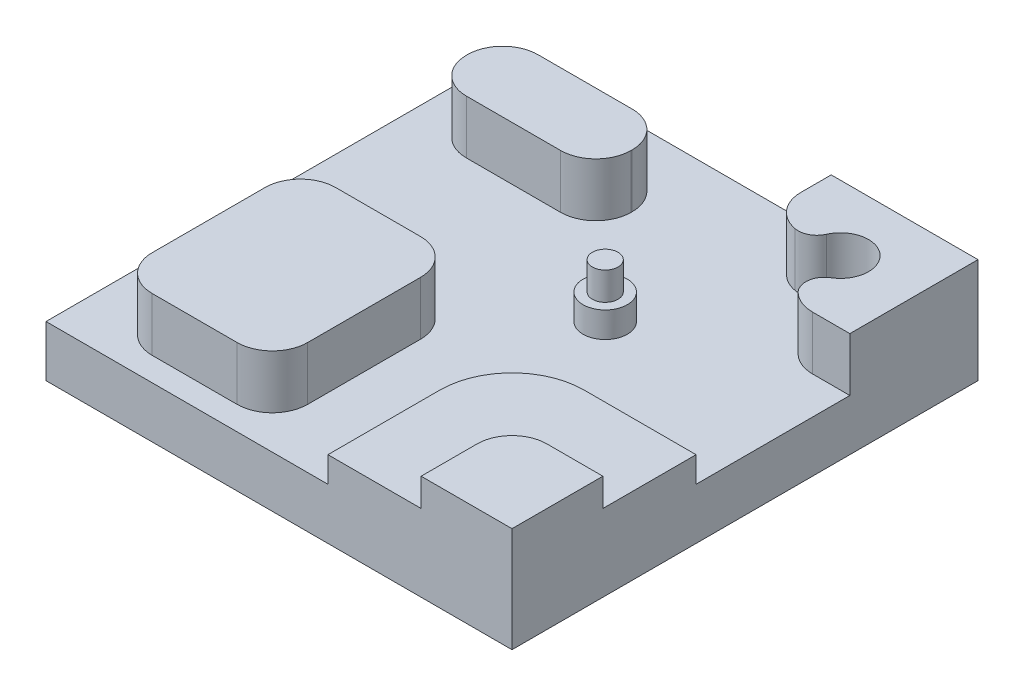
from build123d import *

# Parameters (mm, degrees)
SKETCH1_W           = 50
SKETCH1_H           = 50
BOSS_EXTRUDE1_DEPTH = 5.5
SKETCH2_W           = 9.75
SKETCH2_H           = 9.75
BOSS_EXTRUDE2_DEPTH = 5.75
SKETCH3_W           = 19.75
SKETCH3_H           = 19.75
BOSS_EXTRUDE3_DEPTH = 2.75
FILLET1_R           = 3.75
SKETCH4_W           = 15.75
SKETCH4_H           = 7
BOSS_EXTRUDE4_DEPTH = 5.75
SKETCH5_W           = 7.75
SKETCH5_H           = 6.75
BOSS_EXTRUDE5_DEPTH = 5.75
FILLET2_R           = 3.75
SKETCH6_W           = 16.69
SKETCH6_H           = 19.69
BOSS_EXTRUDE6_DEPTH = 5.75
FILLET3_R           = 3.79
SKETCH7_W           = 17.69
SKETCH7_H           = 7.69
BOSS_EXTRUDE7_DEPTH = 5.75
FILLET4_R           = 3.79
SKETCH8_R           = 2.375
BOSS_EXTRUDE8_DEPTH = 2.75
SKETCH9_R           = 1.375
BOSS_EXTRUDE9_DEPTH = 5.75
FILLET5_R           = 7.75
SKETCH10_R          = 3
CUT_EXTRUDE2_DEPTH  = 5.75
FILLET7_R           = 2


with BuildPart() as part:
    # Sketch1 → Boss-Extrude1 (new body)
    with BuildSketch(Plane(origin=(0, 0, 0), x_dir=(1, 0, 0), z_dir=(0, 1, 0))):
        Rectangle(SKETCH1_W, SKETCH1_H)
    extrude(amount=BOSS_EXTRUDE1_DEPTH)

    # Sketch2 → Boss-Extrude2 (add)
    with BuildSketch(Plane(origin=(0, 5.5, 0), x_dir=(1, 0, 0), z_dir=(0, 1, 0))):
        with Locations((20.125, -20.125)):
            Rectangle(SKETCH2_W, SKETCH2_H)
    extrude(amount=BOSS_EXTRUDE2_DEPTH)

    # Sketch3 → Boss-Extrude3 (add)
    with BuildSketch(Plane(origin=(0, 5.5, 0), x_dir=(1, 0, 0), z_dir=(0, 1, 0))):
        with Locations((15.125, -15.125)):
            Rectangle(SKETCH3_W, SKETCH3_H)
    extrude(amount=BOSS_EXTRUDE3_DEPTH)

    # Fillet1
    fillet1_edges = [part.edges().sort_by_distance(p)[0] for p in [
        (15.25, 9.75, 15.25),
    ]]
    fillet(fillet1_edges, radius=FILLET1_R)

    # Sketch4 → Boss-Extrude4 (add)
    with BuildSketch(Plane(origin=(0, 5.5, 0), x_dir=(1, 0, 0), z_dir=(0, 1, 0))):
        with Locations((17.125, 21.5)):
            Rectangle(SKETCH4_W, SKETCH4_H)
    extrude(amount=BOSS_EXTRUDE4_DEPTH)

    # Sketch5 → Boss-Extrude5 (add)
    with BuildSketch(Plane(origin=(0, 5.5, 0), x_dir=(1, 0, 0), z_dir=(0, 1, 0))):
        with Locations((21.125, 14.625)):
            Rectangle(SKETCH5_W, SKETCH5_H)
    extrude(amount=BOSS_EXTRUDE5_DEPTH)

    # Fillet2
    fillet2_edges = [part.edges().sort_by_distance(p)[0] for p in [
        (17.25, 8.375, -11.25),
        (9.25, 8.375, -18),
    ]]
    fillet(fillet2_edges, radius=FILLET2_R)

    # Sketch6 → Boss-Extrude6 (add)
    with BuildSketch(Plane(origin=(0, 5.5, 0), x_dir=(1, 0, 0), z_dir=(0, 1, 0))):
        with Locations((-11.605, -12.605)):
            Rectangle(SKETCH6_W, SKETCH6_H)
    extrude(amount=BOSS_EXTRUDE6_DEPTH)

    # Fillet3
    fillet3_edges = [part.edges().sort_by_distance(p)[0] for p in [
        (-3.26, 8.375, 2.76),
        (-19.95, 8.375, 2.76),
        (-3.26, 8.375, 22.45),
        (-19.95, 8.375, 22.45),
    ]]
    fillet(fillet3_edges, radius=FILLET3_R)

    # Sketch7 → Boss-Extrude7 (add)
    with BuildSketch(Plane(origin=(0, 5.5, 0), x_dir=(1, 0, 0), z_dir=(0, 1, 0))):
        with Locations((-12.595, 16.595)):
            Rectangle(SKETCH7_W, SKETCH7_H)
    extrude(amount=BOSS_EXTRUDE7_DEPTH)

    # Fillet4
    fillet4_edges = [part.edges().sort_by_distance(p)[0] for p in [
        (-3.75, 8.375, -12.75),
        (-21.44, 8.375, -12.75),
        (-3.75, 8.375, -20.44),
        (-21.44, 8.375, -20.44),
    ]]
    fillet(fillet4_edges, radius=FILLET4_R)

    # Sketch8 → Boss-Extrude8 (add)
    with BuildSketch(Plane(origin=(0, 5.5, 0), x_dir=(1, 0, 0), z_dir=(0, 1, 0))):
        with Locations((5, 5)):
            Circle(SKETCH8_R)
    extrude(amount=BOSS_EXTRUDE8_DEPTH)

    # Sketch9 → Boss-Extrude9 (add)
    with BuildSketch(Plane(origin=(0, 5.5, 0), x_dir=(1, 0, 0), z_dir=(0, 1, 0))):
        with Locations((5, 5)):
            Circle(SKETCH9_R)
    extrude(amount=BOSS_EXTRUDE9_DEPTH)

    # Fillet5
    fillet5_edges = [part.edges().sort_by_distance(p)[0] for p in [
        (5.25, 6.875, 5.25),
    ]]
    fillet(fillet5_edges, radius=FILLET5_R)

    # Sketch10 → Cut-Extrude2 (cut)
    with BuildSketch(Plane(origin=(0, 11.25, 0), x_dir=(1, 0, 0), z_dir=(0, 1, 0))):
        with Locations((17.25, 18)):
            Circle(SKETCH10_R)
    extrude(amount=-CUT_EXTRUDE2_DEPTH, mode=Mode.SUBTRACT)

    # Fillet7
    fillet7_edges = [part.edges().sort_by_distance(p)[0] for p in [
        (17.25, 8.375, -15),
        (14.25, 8.375, -18),
    ]]
    fillet(fillet7_edges, radius=FILLET7_R)


solid = part.part
